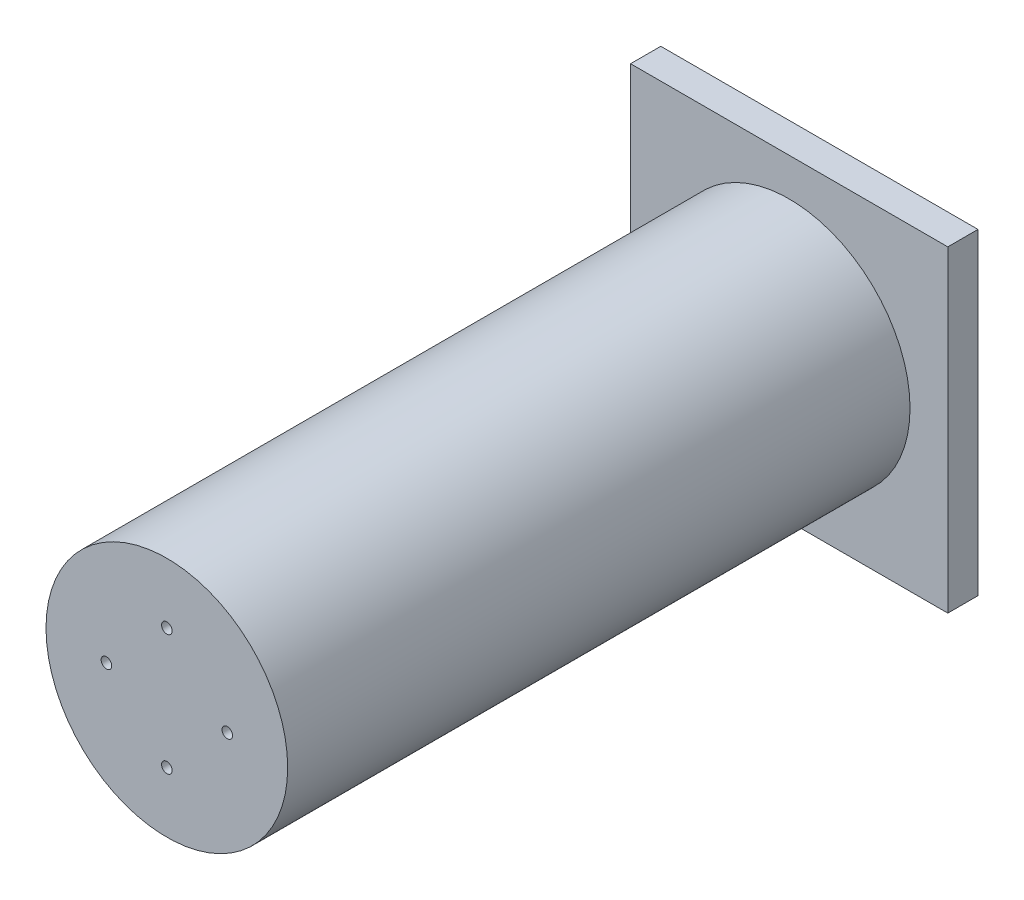
from build123d import *

# Parameters (mm, degrees)
CROQUIS1_W                  = 248.76
CROQUIS1_H                  = 195
SALIENTE_EXTRUIR1_DEPTH     = 5
CROQUIS2_W                  = 48
CROQUIS2_H                  = 30
CROQUIS2_W_2                = 30
CORTAR_EXTRUIR1_DEPTH       = 2
CROQUIS3_R                  = 2.375
CORTAR_EXTRUIR2_DEPTH       = 10
CROQUIS4_R                  = 40
SALIENTE_EXTRUIR2_DEPTH     = 206
CROQUIS5_R                  = 12.5
CORTAR_EXTRUIR3_DEPTH       = 10
CROQUIS12_W                 = 12
CROQUIS12_H                 = 30
SALIENTE_EXTRUIR3_DEPTH     = 4
REDONDEO1_R                 = 10
REDONDEO2_R                 = 10
REDONDEO3_R                 = 10
CORTAR_EXTRUIR5_DEPTH       = 262.677217236
CORTAR_EXTRUIR5_DEPTH_BACK  = 262.677217236
CROQUIS13_R                 = 1.625
CORTAR_EXTRUIR7_DEPTH       = 2
CROQUIS16_R                 = 1.75
CORTAR_EXTRUIR9_DEPTH       = 20
CORTAR_EXTRUIR17_DEPTH      = 313.64182726
CORTAR_EXTRUIR17_DEPTH_BACK = 313.64182726
CROQUIS21_W                 = 105
CROQUIS21_H                 = 105
SALIENTE_EXTRUIR4_DEPTH     = 10


with BuildPart() as part:
    # Croquis1 → Saliente-Extruir1 (new body)
    with BuildSketch(Plane.XY):
        with Locations((7.088293187, 0.26268)):
            Rectangle(CROQUIS1_W, CROQUIS1_H)
    extrude(amount=SALIENTE_EXTRUIR1_DEPTH)

    # Croquis2 → Cortar-Extruir1 (cut)
    with BuildSketch(Plane.XY.offset(5)):
        with Locations((-93.291706813, -82.23732)):
            Rectangle(CROQUIS2_W, CROQUIS2_H)
        with Locations((116.468293187, 82.76268)):
            Rectangle(CROQUIS2_W_2, CROQUIS2_H)
        with Locations((116.468293187, -82.23732)):
            Rectangle(CROQUIS2_W_2, CROQUIS2_H)
        with Locations((-93.291706813, 82.76268)):
            Rectangle(CROQUIS2_W, CROQUIS2_H)
    extrude(amount=-CORTAR_EXTRUIR1_DEPTH, mode=Mode.SUBTRACT)

    # Croquis3 → Cortar-Extruir2 (cut)
    with BuildSketch(Plane.XY.offset(5)):
        with Locations((-93.291706813, 83.76268)):
            Circle(CROQUIS3_R)
        with Locations((-93.291706813, -83.23732)):
            Circle(CROQUIS3_R)
        with Locations((116.468293187, 83.76268)):
            Circle(CROQUIS3_R)
        with Locations((116.468293187, -83.23732)):
            Circle(CROQUIS3_R)
    extrude(amount=-CORTAR_EXTRUIR2_DEPTH, mode=Mode.SUBTRACT)

    # Croquis4 → Saliente-Extruir2 (add)
    with BuildSketch(Plane(origin=(0, 0, 0), x_dir=(-1, 0, 0), z_dir=(0, 0, -1))):
        with Locations((55.101706813, 0.26268)):
            Circle(CROQUIS4_R)
    extrude(amount=SALIENTE_EXTRUIR2_DEPTH)

    # Croquis5 → Cortar-Extruir3 (cut)
    with BuildSketch(Plane(origin=(0, 0, 0), x_dir=(-1, 0, 0), z_dir=(0, 0, -1))):
        with Locations((-76.968293187, 0.26268)):
            Circle(CROQUIS5_R)
    extrude(amount=-CORTAR_EXTRUIR3_DEPTH, mode=Mode.SUBTRACT)

    # Croquis12 → Saliente-Extruir3 (add, symmetric)
    with BuildSketch(Plane(origin=(7.088293187, 0, 0), x_dir=(0, 0, -1), z_dir=(1, 0, 0))):
        with Locations((6, 82.76268)):
            Rectangle(CROQUIS12_W, CROQUIS12_H)
        with Locations((6, -82.23732)):
            Rectangle(CROQUIS12_W, CROQUIS12_H)
    extrude(amount=SALIENTE_EXTRUIR3_DEPTH, both=True)

    # Redondeo1
    redondeo1_edges = [part.edges().sort_by_distance(p)[0] for p in [
        (7.088293187, -67.23732, 0),
        (7.088293187, 67.76268, 0),
    ]]
    fillet(redondeo1_edges, radius=REDONDEO1_R)

    # Redondeo2
    redondeo2_edges = [part.edges().sort_by_distance(p)[0] for p in [
        (7.088293187, 67.76268, -12),
        (7.088293187, -67.23732, -12),
    ]]
    fillet(redondeo2_edges, radius=REDONDEO2_R)

    # Redondeo3
    redondeo3_edges = [part.edges().sort_by_distance(p)[0] for p in [
        (7.088293187, -97.23732, -12),
        (7.088293187, 97.76268, -12),
    ]]
    fillet(redondeo3_edges, radius=REDONDEO3_R)

    # Croquis13 → Cortar-Extruir5 (cut, two sides: drawn at the far end of the back side and taken through both)
    with BuildSketch(Plane(origin=(11.088293187, 0, 0), x_dir=(0, 0, -1), z_dir=(1, 0, 0)).offset(-CORTAR_EXTRUIR5_DEPTH_BACK)):
        with Locations((6, 87.76268)):
            Circle(CROQUIS13_R)
        with Locations((6, 77.76268)):
            Circle(CROQUIS13_R)
        with Locations((6, -77.23732)):
            Circle(CROQUIS13_R)
        with Locations((6, -87.23732)):
            Circle(CROQUIS13_R)
    extrude(amount=CORTAR_EXTRUIR5_DEPTH + CORTAR_EXTRUIR5_DEPTH_BACK, mode=Mode.SUBTRACT)

    # Croquis15 → Cortar-Extruir7 (cut)
    with BuildSketch(Plane.XY.offset(5)):
        Polygon((111.468293187, 67.76268), (131.468293187, 67.76268), (131.468293187, -67.23732), (111.468293187, -67.23732), (111.468293187, -59.48732), (125.218293187, -59.48732), (125.218293187, 60.01268), (111.468293187, 60.01268), align=None)
    extrude(amount=-CORTAR_EXTRUIR7_DEPTH, mode=Mode.SUBTRACT)

    # Croquis16 → Cortar-Extruir9 (cut)
    with BuildSketch(Plane.XY.offset(5)):
        with Locations((-55.101706813, 20.26268)):
            Circle(CROQUIS16_R)
        with Locations((-35.101706813, 0.26268)):
            Circle(CROQUIS16_R)
        with Locations((-55.101706813, -19.73732)):
            Circle(CROQUIS16_R)
        with Locations((-75.101706813, 0.26268)):
            Circle(CROQUIS16_R)
    extrude(amount=-CORTAR_EXTRUIR9_DEPTH, mode=Mode.SUBTRACT)

    # Croquis20 → Cortar-Extruir17 (cut, two sides: drawn at the far end of the back side and taken through both)
    with BuildSketch(Plane.XZ.offset(97.23732).offset(-CORTAR_EXTRUIR17_DEPTH_BACK)):
        Polygon((-117.291706813, 10.531534682), (-117.291706813, 0), (3.088293187, 0), (3.088293187, -12), (11.088293187, -12), (11.088293187, 0), (131.468293187, 0), (131.468293187, 10.531534682), align=None)
    extrude(amount=CORTAR_EXTRUIR17_DEPTH + CORTAR_EXTRUIR17_DEPTH_BACK, mode=Mode.SUBTRACT)

    # Croquis21 → Saliente-Extruir4 (add)
    with BuildSketch(Plane(origin=(0, 0, -206), x_dir=(-1, 0, 0), z_dir=(0, 0, -1))):
        with Locations((55.101706813, 0.26268)):
            Rectangle(CROQUIS21_W, CROQUIS21_H)
    extrude(amount=SALIENTE_EXTRUIR4_DEPTH)


solid = part.part
